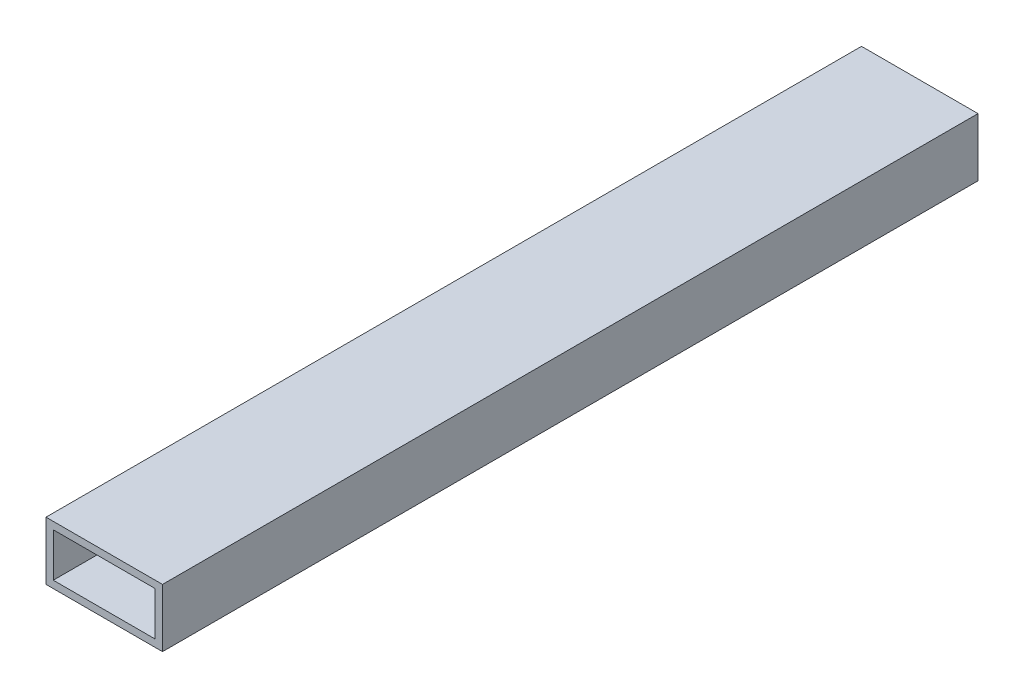
from build123d import *

# Parameters (mm, degrees)
SKETCH1_W           = 50.8
SKETCH1_H           = 25.4
SKETCH1_W_2         = 44.45
SKETCH1_H_2         = 19.05
BOSS_EXTRUDE1_DEPTH = 177.8


with BuildPart() as part:
    # Sketch1 → Boss-Extrude1 (new, symmetric)
    with BuildSketch(Plane.XY):
        Rectangle(SKETCH1_W, SKETCH1_H)
        Rectangle(SKETCH1_W_2, SKETCH1_H_2, mode=Mode.SUBTRACT)
    extrude(amount=BOSS_EXTRUDE1_DEPTH, both=True)


solid = part.part
